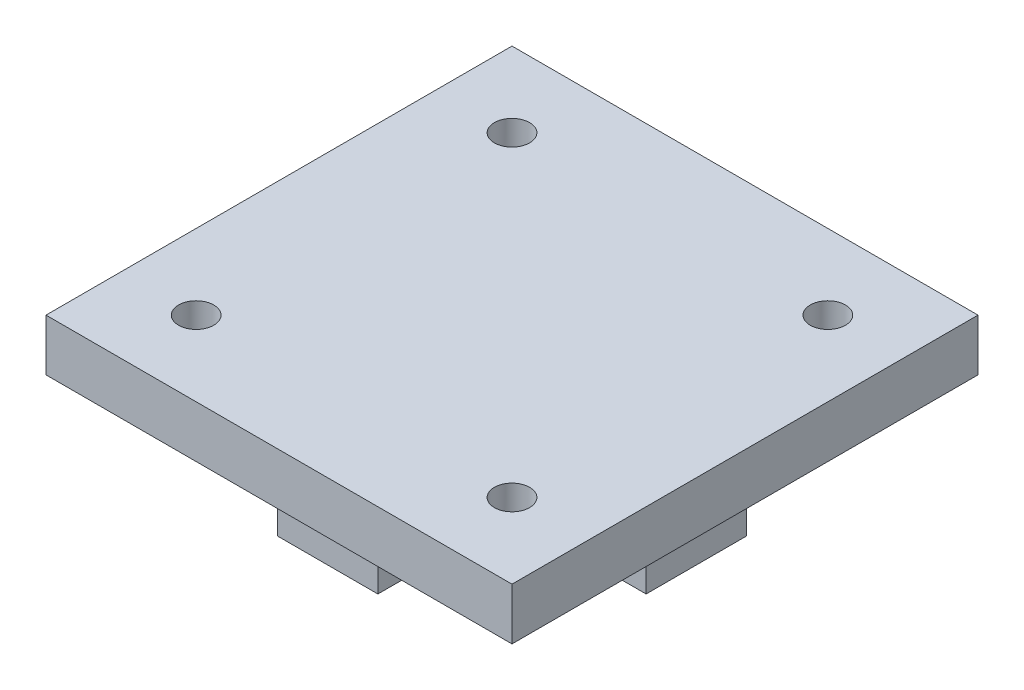
from build123d import *

# Parameters (mm, degrees)
SKETCH1_W               = 45
SKETCH1_H               = 45
BOSS_EXTRUDE1_DEPTH     = 5
SKETCH2_W               = 9.7
SKETCH2_H               = 5.8
SKETCH2_W_2             = 5.8
SKETCH2_H_2             = 9.7
BOSS_EXTRUDE2_DEPTH     = 7
CUT_EXTRUDE1_DEPTH      = 35.007352146
CUT_EXTRUDE1_DEPTH_BACK = 35.007352146
SKETCH3_R               = 1.7
CUT_EXTRUDE2_DEPTH      = 2.5


with BuildPart() as part:
    # Sketch1 → Boss-Extrude1 (new body)
    with BuildSketch(Plane(origin=(0, 0, 0), x_dir=(1, 0, 0), z_dir=(0, 1, 0))):
        Rectangle(SKETCH1_W, SKETCH1_H)
    extrude(amount=-BOSS_EXTRUDE1_DEPTH)

    # Sketch2 → Boss-Extrude2 (add)
    with BuildSketch(Plane.XZ.offset(5)):
        with Locations((0, 14.9)):
            Rectangle(SKETCH2_W, SKETCH2_H)
        with Locations((-14.9, 0)):
            Rectangle(SKETCH2_W_2, SKETCH2_H_2)
        with Locations((14.9, 0)):
            Rectangle(SKETCH2_W_2, SKETCH2_H_2)
        with Locations((0, -14.9)):
            Rectangle(SKETCH2_W, SKETCH2_H)
    extrude(amount=BOSS_EXTRUDE2_DEPTH)

    # Sketch3 → Cut-Extrude1 (cut, two sides: drawn at the far end of the back side and taken through both)
    with BuildSketch(Plane(origin=(0, 0, 0), x_dir=(1, 0, 0), z_dir=(0, 1, 0)).offset(-CUT_EXTRUDE1_DEPTH_BACK)):
        with Locations((-15.25, 15.25)):
            Circle(SKETCH3_R)
        with Locations((15.25, 15.25)):
            Circle(SKETCH3_R)
        with Locations((-15.25, -15.25)):
            Circle(SKETCH3_R)
        with Locations((15.25, -15.25)):
            Circle(SKETCH3_R)
    extrude(amount=CUT_EXTRUDE1_DEPTH + CUT_EXTRUDE1_DEPTH_BACK, mode=Mode.SUBTRACT)

    # Sketch4 → Cut-Extrude2 (cut)
    with BuildSketch(Plane.XZ.offset(5)):
        Polygon((12.6, 13.720021787), (15.25, 12.190043573), (17.9, 13.720021787), (17.9, 16.779978213), (15.25, 18.309956427), (12.6, 16.779978213), align=None)
        Polygon((-13.720021787, 12.6), (-12.190043573, 15.25), (-13.720021787, 17.9), (-16.779978213, 17.9), (-18.309956427, 15.25), (-16.779978213, 12.6), align=None)
        Polygon((13.720021787, -12.6), (12.190043573, -15.25), (13.720021787, -17.9), (16.779978213, -17.9), (18.309956427, -15.25), (16.779978213, -12.6), align=None)
        Polygon((-12.6, -13.720021787), (-15.25, -12.190043573), (-17.9, -13.720021787), (-17.9, -16.779978213), (-15.25, -18.309956427), (-12.6, -16.779978213), align=None)
    extrude(amount=-CUT_EXTRUDE2_DEPTH, mode=Mode.SUBTRACT)


solid = part.part
